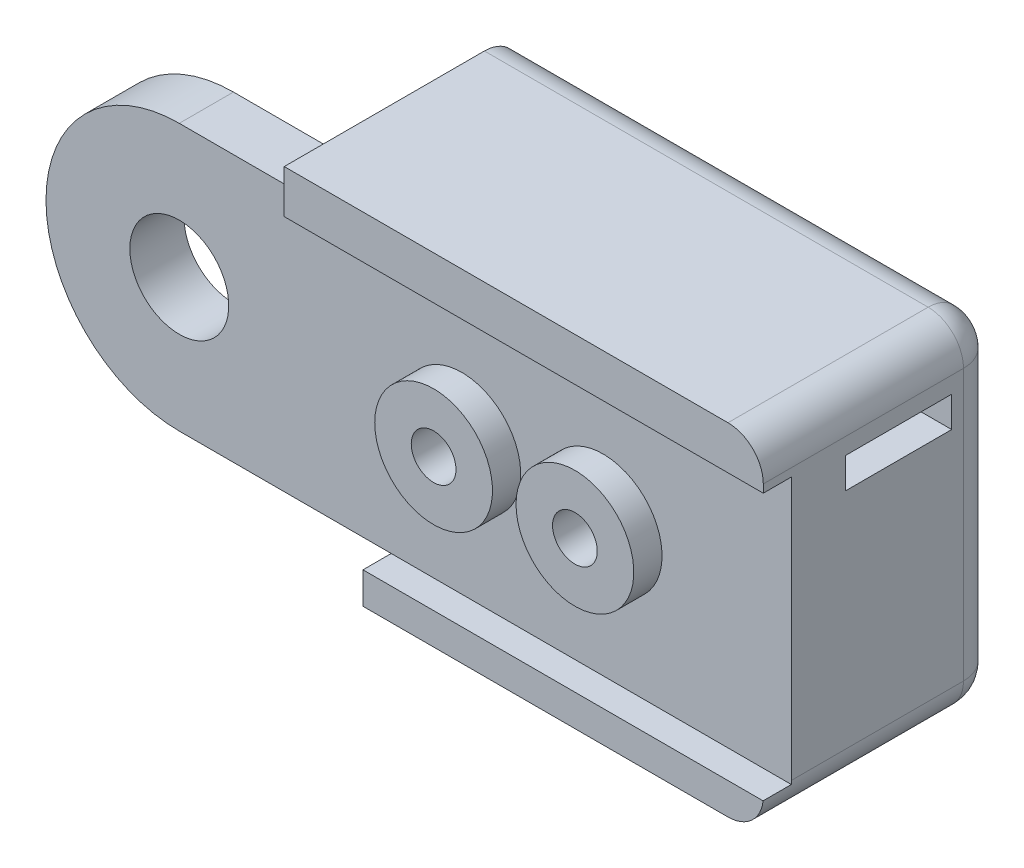
from build123d import *

# Parameters (mm, degrees)
BOSS_EXTRUDE1_DEPTH = 2
BOSS_EXTRUDE2_START = 4.5
BOSS_EXTRUDE2_DEPTH = 4.5
CUT_EXTRUDE1_DEPTH  = 4.5
BOSS_EXTRUDE3_DEPTH = 2.3
SKETCH9_R           = 2.1
CUT_EXTRUDE2_DEPTH  = 2.5
SKETCH10_R          = 2.5
BOSS_EXTRUDE4_DEPTH = 1.2
SKETCH11_R          = 0.95
CUT_EXTRUDE3_DEPTH  = 9.2
SKETCH12_R          = 2
CUT_EXTRUDE4_DEPTH  = 4.5
SKETCH14_W          = 20.343145751
SKETCH14_H          = 1.841510486
SKETCH14_W_2        = 17
SKETCH14_H_2        = 1.341637015
BOSS_EXTRUDE5_DEPTH = 1.2
FILLET1_R           = 1.5
SKETCH17_R          = 0.95
CUT_EXTRUDE5_DEPTH  = 3


# Read off the part's stored shape, not the designer's step: Boss-Extrude3
with BuildPart() as part:
    # Sketch5 → Boss-Extrude1 (new body)
    with BuildSketch(Plane.XY):
        with BuildLine():
            Line((8, 0), (9, -2.501635265))
            Line((9, -2.501635265), (9, -7.001635265))
            Line((9, -7.001635265), (26, -7.001635265))
            Line((26, -7.001635265), (26, 7.498364735))
            Line((26, 7.498364735), (5.656854249, 7.498364735))
            Line((5.656854249, 7.498364735), (5.656854249, 5.656854249))
            ThreePointArc((5.656854249, 5.656854249), (7.39103626, 3.061467459), (8, 0))
        make_face()
    extrude(amount=BOSS_EXTRUDE1_DEPTH)

    # Sketch6 → Boss-Extrude2 (add)
    with BuildSketch(Plane(origin=(0, 0, 0), x_dir=(-1, 0, 0), z_dir=(0, 0, -1)).offset(BOSS_EXTRUDE2_START)):
        with BuildLine():
            Line((-5.656854249, 7.498364735), (-5.656854249, 5.656854249))
            ThreePointArc((-5.656854249, 5.656854249), (-7.39103626, 3.061467459), (-8, 0))
            Line((-8, 0), (-9, -2.501635265))
            Line((-9, -2.501635265), (-9, -7.001635265))
            Line((-9, -7.001635265), (-26, -7.001635265))
            Line((-26, -7.001635265), (-26, 7.498364735))
            Line((-26, 7.498364735), (-5.656854249, 7.498364735))
        make_face()
    extrude(amount=-BOSS_EXTRUDE2_DEPTH)

    # Sketch7 → Cut-Extrude1 (cut)
    with BuildSketch(Plane(origin=(0, 0, -4.5), x_dir=(-1, 0, 0), z_dir=(0, 0, -1))):
        Polygon((-26, 5.298364735), (-2.738141148, 5.298364735), (-2.738141148, 3.998364735), (-29.849535112, 3.998364735), (-29.849535112, 5.298364735), align=None)
    extrude(amount=-CUT_EXTRUDE1_DEPTH, mode=Mode.SUBTRACT)

    # Boss-Extrude3 outline → Boss-Extrude3 (add)
    with BuildSketch(Plane(origin=(0, 0, -4.5), x_dir=(-1, 0, 0), z_dir=(0, 0, -1))):
        with BuildLine():
            Line((-9, -7.001635265), (-9, -5.65999825))
            Line((-9, -5.65999825), (0, -5.659997813))
            ThreePointArc((0, -5.659997813), (5.659997813, 0), (0, 5.659997813))
            Line((0, 5.659997813), (-5.656854249, 5.656854249))
            Line((-5.656854249, 5.656854249), (-5.656854249, 7.498364735))
            Line((-5.656854249, 7.498364735), (-26, 7.498364735))
            Line((-26, 7.498364735), (-26, -7.001635265))
            Line((-26, -7.001635265), (-9, -7.001635265))
        make_face()
    extrude(amount=BOSS_EXTRUDE3_DEPTH)

    # Sketch9 → Cut-Extrude2 (cut)
    with BuildSketch(Plane(origin=(0, 0, -6.8), x_dir=(-1, 0, 0), z_dir=(0, 0, -1))):
        Circle(SKETCH9_R)
    extrude(amount=-CUT_EXTRUDE2_DEPTH, mode=Mode.SUBTRACT)

    # Sketch10 → Boss-Extrude4 (add)
    with BuildSketch(Plane(origin=(0, 0, -6.8), x_dir=(-1, 0, 0), z_dir=(0, 0, -1))):
        with Locations((-12, 0)):
            Circle(SKETCH10_R)
        with Locations((-18, 0)):
            Circle(SKETCH10_R)
    extrude(amount=BOSS_EXTRUDE4_DEPTH)

    # Sketch11 → Cut-Extrude3 (cut)
    with BuildSketch(Plane(origin=(0, 0, -8), x_dir=(-1, 0, 0), z_dir=(0, 0, -1))):
        with Locations((-18, 0)):
            Circle(SKETCH11_R)
        with Locations((-12, 0)):
            Circle(SKETCH11_R)
    extrude(amount=-CUT_EXTRUDE3_DEPTH, mode=Mode.SUBTRACT)

    # Sketch12 → Cut-Extrude4 (cut)
    with BuildSketch(Plane.XY.offset(2)):
        with Locations((12, 0)):
            Circle(SKETCH12_R)
        with Locations((18, 0)):
            Circle(SKETCH12_R)
    extrude(amount=-CUT_EXTRUDE4_DEPTH, mode=Mode.SUBTRACT)

    # Sketch14 → Boss-Extrude5 (add)
    with BuildSketch(Plane(origin=(0, 0, -6.8), x_dir=(-1, 0, 0), z_dir=(0, 0, -1))):
        with Locations((-15.828427124, 6.577609492)):
            Rectangle(SKETCH14_W, SKETCH14_H)
        with Locations((-17.5, -6.330816758)):
            Rectangle(SKETCH14_W_2, SKETCH14_H_2)
    extrude(amount=BOSS_EXTRUDE5_DEPTH)

    # Fillet1
    # the kernel refuses this fillet: 1.5 mm, written as the material it takes off along each edge
    with BuildSketch(Plane(origin=(24.5, -5.501635265, 0.5), x_dir=(0, 0, 1), z_dir=(0, -1, 0))) as fillet1_piece_1_section:
        Polygon((0, 0), (FILLET1_R, 0), (FILLET1_R, -FILLET1_R), (0, -FILLET1_R), align=None)
    fillet1_piece_1 = extrude(amount=FILLET1_R, mode=Mode.PRIVATE)
    fillet1_piece_1 = fillet1_piece_1 - Plane(origin=(24.5, -5.501635265, 0.5), x_dir=(-0.7071067811865475, 0, -0.7071067811865475), z_dir=(0, -1, 0)) * Sphere(FILLET1_R, mode=Mode.PRIVATE)
    add(fillet1_piece_1, mode=Mode.SUBTRACT)
    with BuildSketch(Plane(origin=(24.5, 5.998364735, 0.5), x_dir=(0, 0, 1), z_dir=(0, 1, 0))) as fillet1_piece_2_section:
        Polygon((0, 0), (FILLET1_R, 0), (FILLET1_R, FILLET1_R), (0, FILLET1_R), align=None)
    fillet1_piece_2 = extrude(amount=FILLET1_R, mode=Mode.PRIVATE)
    fillet1_piece_2 = fillet1_piece_2 - Plane(origin=(24.5, 5.998364735, 0.5), x_dir=(-0.7071067811865475, 0, -0.7071067811865475), z_dir=(0, 1, 0)) * Sphere(FILLET1_R, mode=Mode.PRIVATE)
    add(fillet1_piece_2, mode=Mode.SUBTRACT)
    with BuildSketch(Plane(origin=(26, -5.501635265, 2), x_dir=(-1, 0, 0), z_dir=(0, 1, 0))) as fillet1_piece_3:
        with BuildLine():
            CenterArc((FILLET1_R, -FILLET1_R), FILLET1_R, 90, 90)
            Line((0, -FILLET1_R), (0, 0))
            Line((0, 0), (FILLET1_R, 0))
        make_face()
    extrude(amount=11.5, mode=Mode.SUBTRACT)
    with BuildSketch(Plane(origin=(26, -7.001635265, -4.5), x_dir=(-1, 0, 0), z_dir=(0, 0, 1))) as fillet1_piece_4:
        with BuildLine():
            CenterArc((FILLET1_R, -FILLET1_R), FILLET1_R, 90, 90)
            Line((0, -FILLET1_R), (0, 0))
            Line((0, 0), (FILLET1_R, 0))
        make_face()
    extrude(amount=5, mode=Mode.SUBTRACT)
    with BuildSketch(Plane(origin=(5.25, -7.001635265, 2), x_dir=(0, 1, 0), z_dir=(1, 0, 0))) as fillet1_piece_5:
        with BuildLine():
            CenterArc((FILLET1_R, -FILLET1_R), FILLET1_R, 90, 90)
            Line((0, -FILLET1_R), (0, 0))
            Line((0, 0), (FILLET1_R, 0))
        make_face()
    extrude(amount=19.25, mode=Mode.SUBTRACT)
    with BuildSketch(Plane(origin=(24.5, 7.498364735, 2), x_dir=(0, -1, 0), z_dir=(-1, 0, 0))) as fillet1_piece_6:
        with BuildLine():
            CenterArc((FILLET1_R, -FILLET1_R), FILLET1_R, 90, 90)
            Line((0, -FILLET1_R), (0, 0))
            Line((0, 0), (FILLET1_R, 0))
        make_face()
    extrude(amount=22.593145751, mode=Mode.SUBTRACT)
    with BuildSketch(Plane(origin=(26, 7.498364735, -4.5), x_dir=(-1, 0, 0), z_dir=(0, 0, 1))) as fillet1_piece_7:
        with BuildLine():
            CenterArc((FILLET1_R, FILLET1_R), FILLET1_R, 180, 90)
            Line((0, FILLET1_R), (0, 0))
            Line((0, 0), (FILLET1_R, 0))
        make_face()
    extrude(amount=5, mode=Mode.SUBTRACT)
    with BuildSketch(Plane(origin=(26, 7.498364735, -4.5), x_dir=(-1.0, -1.9174232572065026e-10, 0), z_dir=(0, 0, -1))) as fillet1_piece_8:
        with BuildLine():
            CenterArc((FILLET1_R, -FILLET1_R), FILLET1_R, 90.000000011, 90)
            Line((FILLET1_R * 1.9173522033e-10, -FILLET1_R), (0, 0))
            Line((0, 0), (FILLET1_R, 0))
        make_face()
    extrude(amount=2.3, mode=Mode.SUBTRACT)
    with BuildSketch(Plane(origin=(26, 7.498364735, -6.8), x_dir=(-1, 0, 0), z_dir=(0, 0, -1))) as fillet1_piece_9:
        with BuildLine():
            CenterArc((FILLET1_R, -FILLET1_R), FILLET1_R, 90, 90)
            Line((0, -FILLET1_R), (0, 0))
            Line((0, 0), (FILLET1_R, 0))
        make_face()
    extrude(amount=4.95, mode=Mode.SUBTRACT)
    with BuildSketch(Plane(origin=(26, -7.001635265, -4.5), x_dir=(-1.0, -1.9169850891861218e-10, 0), z_dir=(0, 0, -1))) as fillet1_piece_10:
        with BuildLine():
            CenterArc((FILLET1_R, FILLET1_R), FILLET1_R, 180.000000011, 90)
            Line((-FILLET1_R * 1.91707982785e-10, FILLET1_R), (0, 0))
            Line((0, 0), (FILLET1_R, 0))
        make_face()
    extrude(amount=2.3, mode=Mode.SUBTRACT)
    with BuildSketch(Plane(origin=(26, -7.001635265, -6.8), x_dir=(-1, 0, 0), z_dir=(0, 0, -1))) as fillet1_piece_11:
        with BuildLine():
            CenterArc((FILLET1_R, FILLET1_R), FILLET1_R, 180, 90)
            Line((0, FILLET1_R), (0, 0))
            Line((0, 0), (FILLET1_R, 0))
        make_face()
    extrude(amount=4.95, mode=Mode.SUBTRACT)

    # Sketch17 → Cut-Extrude5 (cut)
    with BuildSketch(Plane.XZ.offset(7.001635265)):
        with Locations((22, -1)):
            Circle(SKETCH17_R)
        with Locations((18, -1)):
            Circle(SKETCH17_R)
    extrude(amount=-CUT_EXTRUDE5_DEPTH, mode=Mode.SUBTRACT)

    # Mirror1: part across plane


with BuildPart() as part_1:
    add(part.part)
    add(part.part.mirror(Plane(origin=(0, 0, -8), x_dir=(1, 0, 0), z_dir=(0, 0, -1))))


with BuildPart() as body_2:
    # Split1: the piece on the far side of the plane
    add(part_1.part)
    split(bisect_by=Plane(origin=(0, 0, -8), x_dir=(-1, 0, 0), z_dir=(0, 0, -1)), keep=Keep.BOTTOM)


with BuildPart() as part_2:
    add(part_1.part)

    # Split1
    split(bisect_by=Plane(origin=(0, 0, -8), x_dir=(-1, 0, 0), z_dir=(0, 0, -1)), keep=Keep.TOP)


solid = part_2.part
